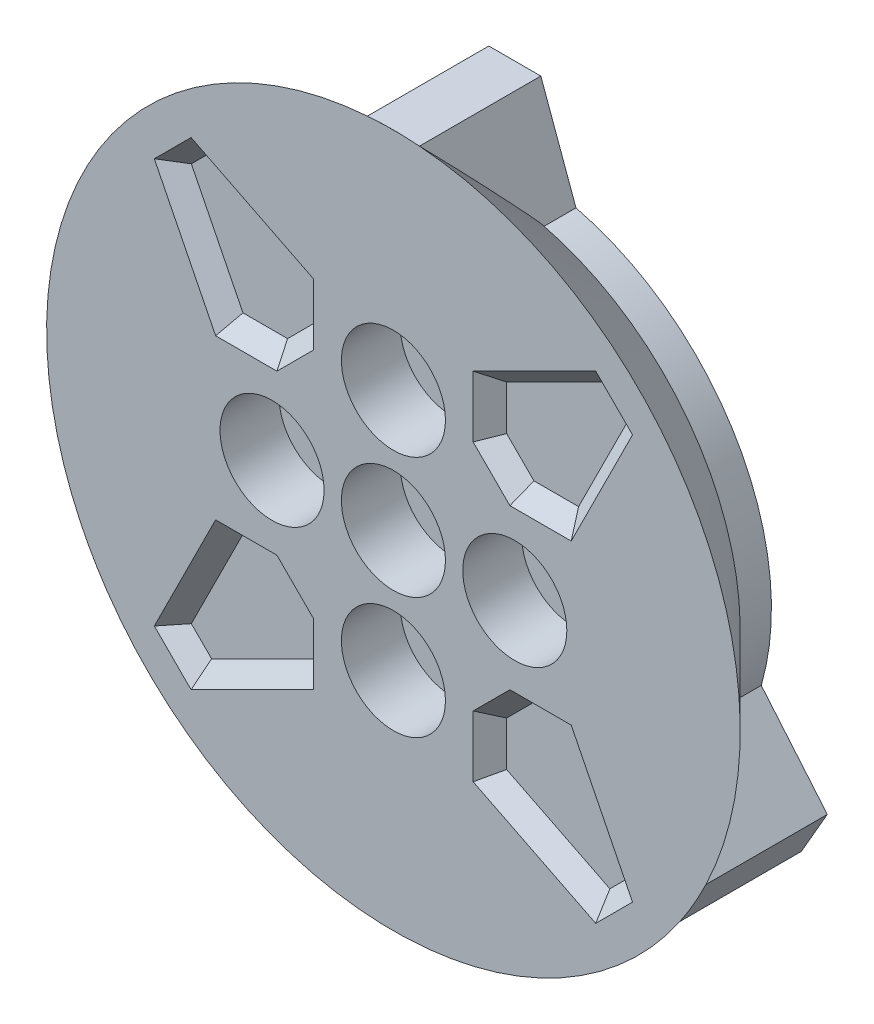
from build123d import *

# Parameters (mm, degrees)
ESQUISSE3_R                         = 14.8
BOSS_EXTRU_1_DEPTH                  = 2
BOSS_EXTRU_2_REACH                  = 31.138
R_P_TITION_CIRCULAIRE1_COUNT        = 3
ENL_V_MAT_EXTRU_1_DEPTH             = 30.137604569
ENL_V_MAT_EXTRU_1_DEPTH_BACK        = 30.137604569
ESQUISSE5_R                         = 1.625
PER_AGEAVANC_1_START                = -3.4
PER_AGEAVANC_1_OUTLINE_R            = 3
PER_AGEAVANC_1_OUTLINE_R_2          = 1.625
PER_AGEAVANC_1_DEPTH                = 3.4000121
ENL_V_MAT_EXTRU_2_DEPTH             = 1
ENL_V_MAT_EXTRU_2_DRAFT             = -43
R_P_TITION_CIRCULAIRE2_COPY_1_DEPTH = 1
R_P_TITION_CIRCULAIRE2_COPY_1_DRAFT = -43
R_P_TITION_CIRCULAIRE2_COPY_2_DEPTH = 1
R_P_TITION_CIRCULAIRE2_COPY_2_DRAFT = -43
R_P_TITION_CIRCULAIRE2_COPY_3_DEPTH = 1
R_P_TITION_CIRCULAIRE2_COPY_3_DRAFT = -43


with BuildPart() as part:
    # Esquisse2 → Révolution1 (revolve)
    with BuildSketch(Plane(origin=(0, 0, 0), x_dir=(0, 0, -1), z_dir=(1, 0, 0)), mode=Mode.PRIVATE) as r_volution1_sk:
        Polygon((0, 0), (0, 20), (5, 15), (5, 0), align=None)
    revolve(r_volution1_sk.sketch.rotate(Axis((0, 0, 0), (0, 0, -1)), 90), axis=Axis((0, 0, 0), (0, 0, -1)))

    # Esquisse3 → Boss.-Extru.1 (add)
    with BuildSketch(Plane(origin=(0, 0, -5), x_dir=(-1, 0, 0), z_dir=(0, 0, -1))):
        Circle(ESQUISSE3_R)
    extrude(amount=BOSS_EXTRU_1_DEPTH)

    # Boss.-Extru.2: up to this face of the body (flat: up to its plane)
    boss_extru_2_end = Plane(part.part.faces().sort_by_distance((0, 0, -7))[0])
    # Esquisse4 → Boss.-Extru.2 (add, up to the picked face)
    with BuildSketch(Plane.XY, mode=Mode.PRIVATE) as boss_extru_2_sk1:
        with BuildLine():
            Line((1.5, 19.943670675), (-1.5, 19.943670675))
            Line((-1.5, 19.943670675), (-3.52737474, 14.373504355))
            ThreePointArc((-3.52737474, 14.373504355), (0, 14.8), (3.52737474, 14.373504355))
            Line((3.52737474, 14.373504355), (1.5, 19.943670675))
        make_face()
    boss_extru_2_tool1 = split(extrude(boss_extru_2_sk1.sketch, amount=-BOSS_EXTRU_2_REACH, mode=Mode.PRIVATE), bisect_by=boss_extru_2_end, keep=Keep.BOTH, mode=Mode.PRIVATE)
    boss_extru_2 = boss_extru_2_tool1.solids().sort_by(Axis((0, 16.957577, 0), (0, 0, -1)))[0]
    add(boss_extru_2)

    # Répétition circulaire1: Boss.-Extru.2 ×3 about axis
    r_p_tition_circulaire1_axis = Axis((0, 0, 0), (0, 0, 1))
    for i in range(1, R_P_TITION_CIRCULAIRE1_COUNT):
        add(boss_extru_2.rotate(r_p_tition_circulaire1_axis, i * 360 / R_P_TITION_CIRCULAIRE1_COUNT))

    # Esquisse5 → Enlèv. mat.-Extru.1 (cut, two sides: drawn at the far end of the back side and taken through both)
    with BuildSketch(Plane.XY.offset(-ENL_V_MAT_EXTRU_1_DEPTH_BACK)):
        with Locations((0, 7)):
            Circle(ESQUISSE5_R)
        Circle(ESQUISSE5_R)
        with Locations((7, 0)):
            Circle(ESQUISSE5_R)
        with Locations((0, -7)):
            Circle(ESQUISSE5_R)
        with Locations((-7, 0)):
            Circle(ESQUISSE5_R)
    extrude(amount=ENL_V_MAT_EXTRU_1_DEPTH + ENL_V_MAT_EXTRU_1_DEPTH_BACK, mode=Mode.SUBTRACT)

    # PerçageAvancé1: read off the stored shape, not the designer's step
    # PerçageAvancé1 outline → PerçageAvancé1 (cut)
    # profile 1 of 5: a face of its own
    with BuildSketch(Plane.XY.offset(PER_AGEAVANC_1_START)):
        with Locations((0, -7)):
            Circle(PER_AGEAVANC_1_OUTLINE_R)
        with Locations((0, -7)):
            Circle(PER_AGEAVANC_1_OUTLINE_R_2, mode=Mode.SUBTRACT)
    # profile 2 of 5: a face of its own
    with BuildSketch(Plane.XY.offset(PER_AGEAVANC_1_START)):
        with Locations((7, 0)):
            Circle(PER_AGEAVANC_1_OUTLINE_R)
        with Locations((7, 0)):
            Circle(PER_AGEAVANC_1_OUTLINE_R_2, mode=Mode.SUBTRACT)
    # profile 3 of 5: a face of its own
    with BuildSketch(Plane.XY.offset(PER_AGEAVANC_1_START)):
        Circle(PER_AGEAVANC_1_OUTLINE_R)
        Circle(PER_AGEAVANC_1_OUTLINE_R_2, mode=Mode.SUBTRACT)
    # profile 4 of 5: a face of its own
    with BuildSketch(Plane.XY.offset(PER_AGEAVANC_1_START)):
        with Locations((0, 7)):
            Circle(PER_AGEAVANC_1_OUTLINE_R)
        with Locations((0, 7)):
            Circle(PER_AGEAVANC_1_OUTLINE_R_2, mode=Mode.SUBTRACT)
    # profile 5 of 5: a face of its own
    with BuildSketch(Plane.XY.offset(PER_AGEAVANC_1_START)):
        with Locations((-7, 0)):
            Circle(PER_AGEAVANC_1_OUTLINE_R)
        with Locations((-7, 0)):
            Circle(PER_AGEAVANC_1_OUTLINE_R_2, mode=Mode.SUBTRACT)
    extrude(amount=PER_AGEAVANC_1_DEPTH, mode=Mode.SUBTRACT)


with BuildPart() as enl_v_mat_extru_2_tool:
    # Esquisse9 → Enlèv. mat.-Extru.2 (with draft: the straight prism first)
    with BuildSketch(Plane.XY):
        Polygon((-13.788582233, 11.66726189), (-10.253048327, 4.596194078), (-6.717514421, 4.596194078), (-4.596194078, 6.717514421), (-4.596194078, 10.253048327), (-11.66726189, 13.788582233), align=None)
    extrude(amount=-ENL_V_MAT_EXTRU_2_DEPTH)
    # Enlèv. mat.-Extru.2: the draft: its side faces are tilted about the plane it starts from
    enl_v_mat_extru_2_sides = [enl_v_mat_extru_2_tool.faces().sort_by_distance(p)[0] for p in [
        (-12.02081528, 8.131727984, -0.5),
        (-8.485281374, 4.596194078, -0.5),
        (-5.656854249, 5.656854249, -0.5),
        (-4.596194078, 8.485281374, -0.5),
        (-8.131727984, 12.02081528, -0.5),
        (-12.727922061, 12.727922061, -0.5),
    ]]
    draft(enl_v_mat_extru_2_sides, Plane.XY, ENL_V_MAT_EXTRU_2_DRAFT)


with BuildPart() as part_1:
    add(part.part)

    # Enlèv. mat.-Extru.2: cut by enl_v_mat_extru_2_tool
    add(enl_v_mat_extru_2_tool.part, mode=Mode.SUBTRACT)


with BuildPart() as r_p_tition_circulaire2_copy_1_tool:
    # Répétition circulaire2 copy 1 sketch → Répétition circulaire2 copy 1 (with draft: the straight prism first)
    with BuildSketch(Plane(origin=(0, 0, 0), x_dir=(0, 1, 0), z_dir=(0, 0, 1))):
        Polygon((-13.788582233, 11.66726189), (-10.253048327, 4.596194078), (-6.717514421, 4.596194078), (-4.596194078, 6.717514421), (-4.596194078, 10.253048327), (-11.66726189, 13.788582233), align=None)
    extrude(amount=-R_P_TITION_CIRCULAIRE2_COPY_1_DEPTH)
    # Répétition circulaire2 copy 1: the draft: its side faces are tilted about the plane it starts from
    r_p_tition_circulaire2_copy_1_sides = [r_p_tition_circulaire2_copy_1_tool.faces().sort_by_distance(p)[0] for p in [
        (-8.131727984, -12.02081528, -0.5),
        (-4.596194078, -8.485281374, -0.5),
        (-5.656854249, -5.656854249, -0.5),
        (-8.485281374, -4.596194078, -0.5),
        (-12.02081528, -8.131727984, -0.5),
        (-12.727922061, -12.727922061, -0.5),
    ]]
    draft(r_p_tition_circulaire2_copy_1_sides, Plane(origin=(0, 0, 0), x_dir=(0, 1, 0), z_dir=(0, 0, 1)), R_P_TITION_CIRCULAIRE2_COPY_1_DRAFT)


with BuildPart() as part_2:
    add(part_1.part)

    # Répétition circulaire2 copy 1: cut by r_p_tition_circulaire2_copy_1_tool
    add(r_p_tition_circulaire2_copy_1_tool.part, mode=Mode.SUBTRACT)


with BuildPart() as r_p_tition_circulaire2_copy_2_tool:
    # Répétition circulaire2 copy 2 sketch → Répétition circulaire2 copy 2 (with draft: the straight prism first)
    with BuildSketch(Plane(origin=(0, 0, 0), x_dir=(-1, 0, 0), z_dir=(0, 0, 1))):
        Polygon((-13.788582233, 11.66726189), (-10.253048327, 4.596194078), (-6.717514421, 4.596194078), (-4.596194078, 6.717514421), (-4.596194078, 10.253048327), (-11.66726189, 13.788582233), align=None)
    extrude(amount=-R_P_TITION_CIRCULAIRE2_COPY_2_DEPTH)
    # Répétition circulaire2 copy 2: the draft: its side faces are tilted about the plane it starts from
    r_p_tition_circulaire2_copy_2_sides = [r_p_tition_circulaire2_copy_2_tool.faces().sort_by_distance(p)[0] for p in [
        (12.02081528, -8.131727984, -0.5),
        (8.485281374, -4.596194078, -0.5),
        (5.656854249, -5.656854249, -0.5),
        (4.596194078, -8.485281374, -0.5),
        (8.131727984, -12.02081528, -0.5),
        (12.727922061, -12.727922061, -0.5),
    ]]
    draft(r_p_tition_circulaire2_copy_2_sides, Plane(origin=(0, 0, 0), x_dir=(-1, 0, 0), z_dir=(0, 0, 1)), R_P_TITION_CIRCULAIRE2_COPY_2_DRAFT)


with BuildPart() as part_3:
    add(part_2.part)

    # Répétition circulaire2 copy 2: cut by r_p_tition_circulaire2_copy_2_tool
    add(r_p_tition_circulaire2_copy_2_tool.part, mode=Mode.SUBTRACT)


with BuildPart() as r_p_tition_circulaire2_copy_3_tool:
    # Répétition circulaire2 copy 3 sketch → Répétition circulaire2 copy 3 (with draft: the straight prism first)
    with BuildSketch(Plane(origin=(0, 0, 0), x_dir=(0, -1, 0), z_dir=(0, 0, 1))):
        Polygon((-13.788582233, 11.66726189), (-10.253048327, 4.596194078), (-6.717514421, 4.596194078), (-4.596194078, 6.717514421), (-4.596194078, 10.253048327), (-11.66726189, 13.788582233), align=None)
    extrude(amount=-R_P_TITION_CIRCULAIRE2_COPY_3_DEPTH)
    # Répétition circulaire2 copy 3: the draft: its side faces are tilted about the plane it starts from
    r_p_tition_circulaire2_copy_3_sides = [r_p_tition_circulaire2_copy_3_tool.faces().sort_by_distance(p)[0] for p in [
        (8.131727984, 12.02081528, -0.5),
        (4.596194078, 8.485281374, -0.5),
        (5.656854249, 5.656854249, -0.5),
        (8.485281374, 4.596194078, -0.5),
        (12.02081528, 8.131727984, -0.5),
        (12.727922061, 12.727922061, -0.5),
    ]]
    draft(r_p_tition_circulaire2_copy_3_sides, Plane(origin=(0, 0, 0), x_dir=(0, -1, 0), z_dir=(0, 0, 1)), R_P_TITION_CIRCULAIRE2_COPY_3_DRAFT)


with BuildPart() as part_4:
    add(part_3.part)

    # Répétition circulaire2 copy 3: cut by r_p_tition_circulaire2_copy_3_tool
    add(r_p_tition_circulaire2_copy_3_tool.part, mode=Mode.SUBTRACT)


solid = part_4.part
